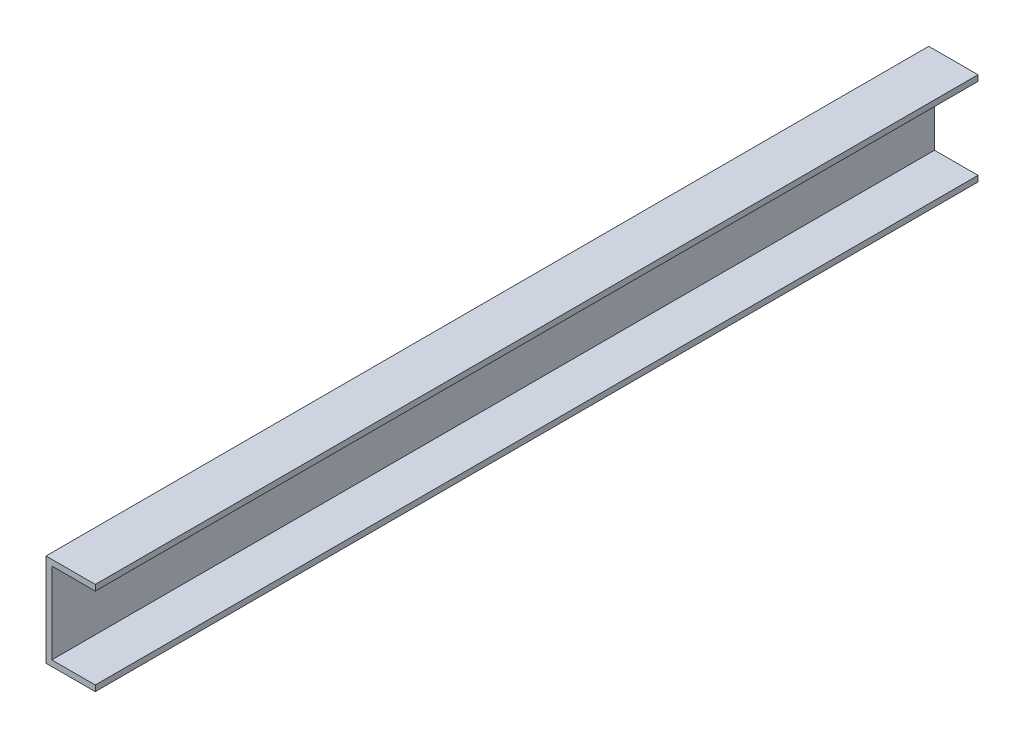
from build123d import *

# Parameters (mm, degrees)
BOSS_EXTRUDE1_DEPTH = 241.3


with BuildPart() as part:
    # Sketch1 → Boss-Extrude1 (new, symmetric)
    with BuildSketch(Plane.XY):
        Polygon((0, 0), (26.931015876, 0), (26.931015876, 3.175), (3.175, 3.175), (3.175, 47.625), (26.931015876, 47.625), (26.931015876, 50.8), (0, 50.8), align=None)
    extrude(amount=BOSS_EXTRUDE1_DEPTH, both=True)


solid = part.part
